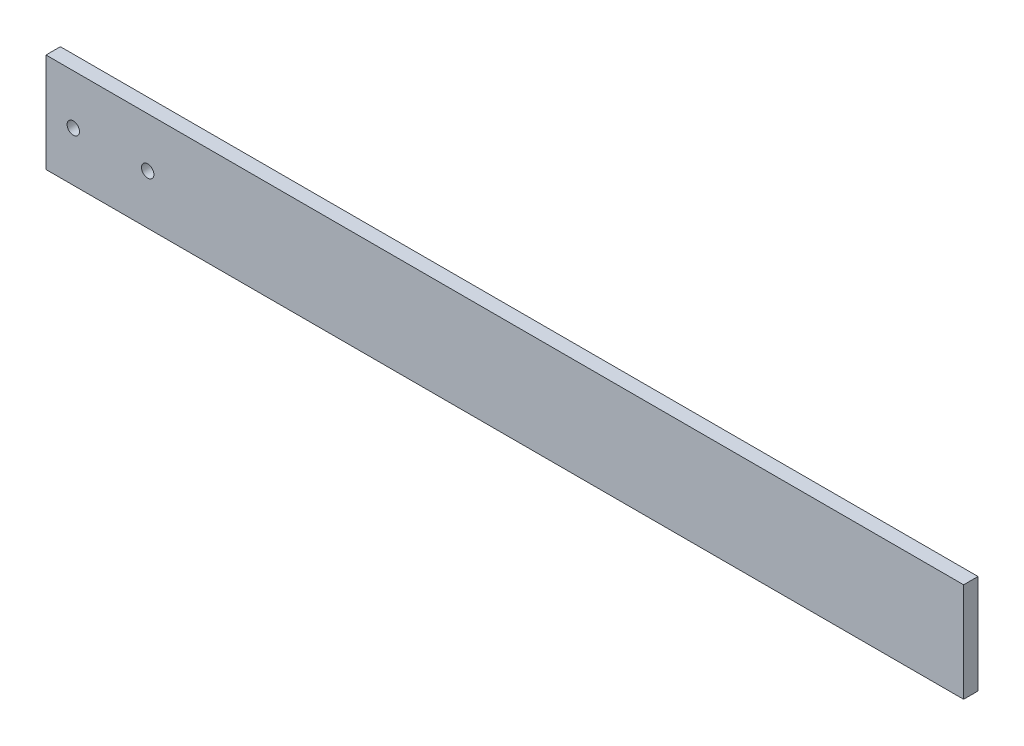
from build123d import *

# Parameters (mm, degrees)
SKETCH1_W           = 185
SKETCH1_H           = 20
BOSS_EXTRUDE1_DEPTH = 2.9
CUT_EXTRUDE1_REACH  = 95.084
SKETCH2_R           = 1.25


with BuildPart() as part:
    # Sketch1 → Boss-Extrude1 (new body)
    with BuildSketch(Plane.XY):
        Rectangle(SKETCH1_W, SKETCH1_H)
    extrude(amount=-BOSS_EXTRUDE1_DEPTH)

    # Sketch2 → Cut-Extrude1 (cut, up to next)
    with BuildSketch(Plane.XY, mode=Mode.PRIVATE) as cut_extrude1_sk1:
        with Locations((-87, 0)):
            Circle(SKETCH2_R)
    cut_extrude1_tool1 = extrude(cut_extrude1_sk1.sketch, amount=-CUT_EXTRUDE1_REACH, mode=Mode.PRIVATE) & part.part
    # Sketch2 → Cut-Extrude1 (cut, up to next)
    with BuildSketch(Plane.XY, mode=Mode.PRIVATE) as cut_extrude1_sk2:
        with Locations((-72, 0)):
            Circle(SKETCH2_R)
    cut_extrude1_tool2 = extrude(cut_extrude1_sk2.sketch, amount=-CUT_EXTRUDE1_REACH, mode=Mode.PRIVATE) & part.part
    add(cut_extrude1_tool1.solids().sort_by_distance((-87, 0, 0))[0], mode=Mode.SUBTRACT)
    add(cut_extrude1_tool2.solids().sort_by_distance((-72, 0, 0))[0], mode=Mode.SUBTRACT)


solid = part.part
